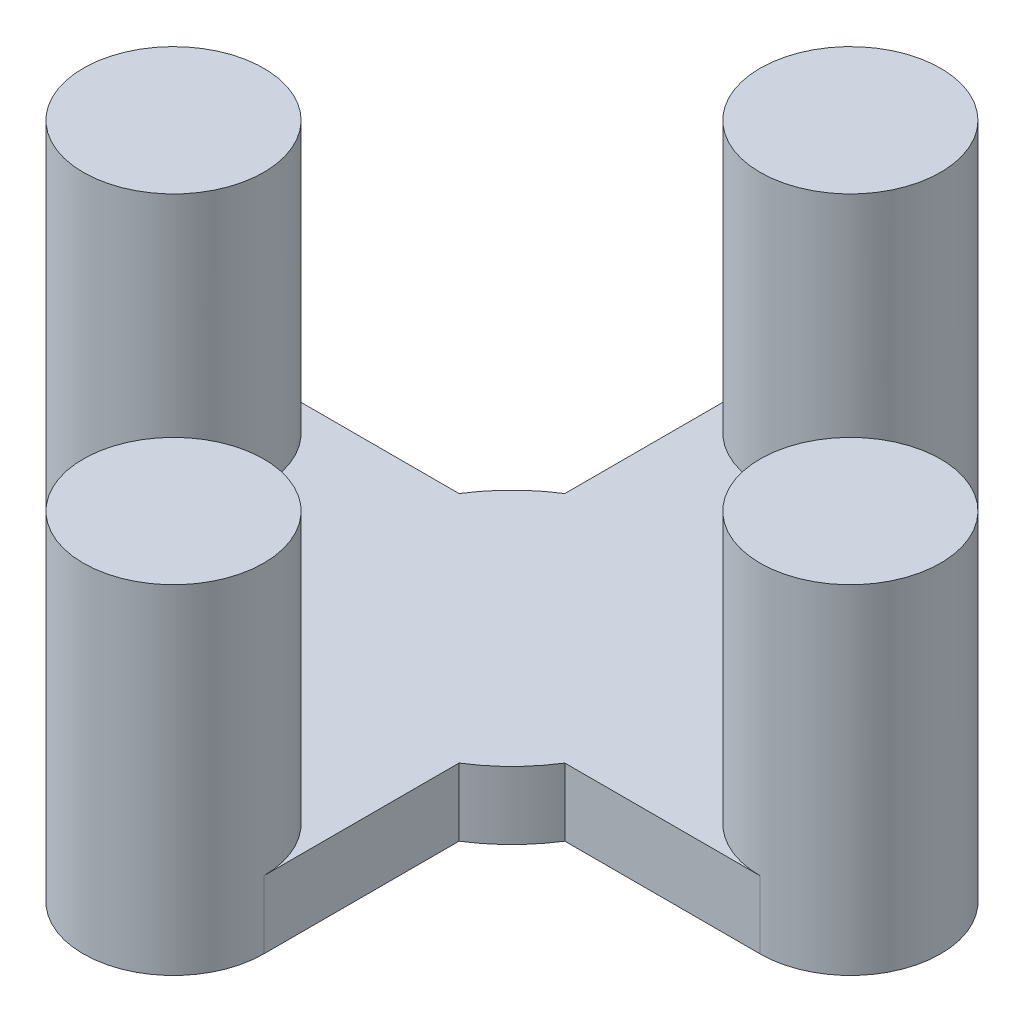
from build123d import *

# Parameters (mm, degrees)
BOSS_EXTRUDE1_DEPTH = 3
SKETCH2_R           = 4
BOSS_EXTRUDE2_DEPTH = 12


with BuildPart() as part:
    # Sketch1 → Boss-Extrude1 (new body)
    with BuildSketch(Plane(origin=(0, 0, 0), x_dir=(1, 0, 0), z_dir=(0, 1, 0))):
        with BuildLine():
            Line((-15, 4), (-6.34428877, 4))
            ThreePointArc((-6.34428877, 4), (-5.303300859, 5.303300859), (-4, 6.34428877))
            Line((-4, 6.34428877), (-4, 15))
            ThreePointArc((-4, 15), (0, 19), (4, 15))
            Line((4, 15), (4, 6.34428877))
            ThreePointArc((4, 6.34428877), (5.303300859, 5.303300859), (6.34428877, 4))
            Line((6.34428877, 4), (15, 4))
            ThreePointArc((15, 4), (19, 0), (15, -4))
            Line((15, -4), (6.34428877, -4))
            ThreePointArc((6.34428877, -4), (5.303300859, -5.303300859), (4, -6.34428877))
            Line((4, -6.34428877), (4, -15))
            ThreePointArc((4, -15), (0, -19), (-4, -15))
            Line((-4, -15), (-4, -6.34428877))
            ThreePointArc((-4, -6.34428877), (-5.303300859, -5.303300859), (-6.34428877, -4))
            Line((-6.34428877, -4), (-15, -4))
            ThreePointArc((-15, -4), (-19, 0), (-15, 4))
        make_face()
    extrude(amount=BOSS_EXTRUDE1_DEPTH)

    # Sketch2 → Boss-Extrude2 (add)
    with BuildSketch(Plane(origin=(0, 3, 0), x_dir=(1, 0, 0), z_dir=(0, 1, 0))):
        with Locations((-15, 0)):
            Circle(SKETCH2_R)
        with Locations((15, 0)):
            Circle(SKETCH2_R)
        with Locations((0, -15)):
            Circle(SKETCH2_R)
        with Locations((0, 15)):
            Circle(SKETCH2_R)
    extrude(amount=BOSS_EXTRUDE2_DEPTH)


solid = part.part
